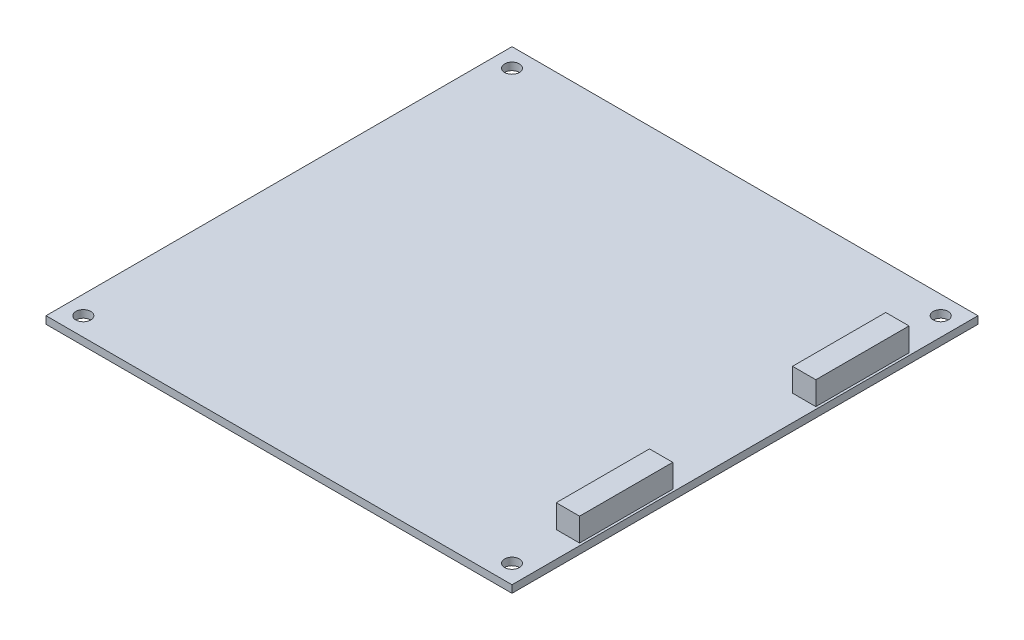
from build123d import *

# Parameters (mm, degrees)
SKETCH1_W           = 100
SKETCH1_H           = 100
BOSS_EXTRUDE1_DEPTH = 1.6
SKETCH2_R           = 1.6
CUT_EXTRUDE1_DEPTH  = 71.728777736
SKETCH3_W           = 5
SKETCH3_H           = 20
BOSS_EXTRUDE2_DEPTH = 5


with BuildPart() as part:
    # Sketch1 → Boss-Extrude1 (new body)
    with BuildSketch(Plane(origin=(0, 0, 0), x_dir=(1, 0, 0), z_dir=(0, 1, 0))):
        Rectangle(SKETCH1_W, SKETCH1_H)
    extrude(amount=BOSS_EXTRUDE1_DEPTH)

    # Sketch2 → Cut-Extrude1 (cut, through all)
    with BuildSketch(Plane(origin=(0, 1.6, 0), x_dir=(1, 0, 0), z_dir=(0, 1, 0))):
        with Locations((-46, -46)):
            Circle(SKETCH2_R)
        with Locations((-46, 46)):
            Circle(SKETCH2_R)
        with Locations((46, 46)):
            Circle(SKETCH2_R)
        with Locations((46, -46)):
            Circle(SKETCH2_R)
    extrude(amount=-CUT_EXTRUDE1_DEPTH, mode=Mode.SUBTRACT)

    # Sketch3 → Boss-Extrude2 (add)
    with BuildSketch(Plane(origin=(0, 1.6, 0), x_dir=(1, 0, 0), z_dir=(0, 1, 0))):
        with Locations((47, -25)):
            Rectangle(SKETCH3_W, SKETCH3_H)
        with Locations((47, 25.7)):
            Rectangle(SKETCH3_W, SKETCH3_H)
    extrude(amount=BOSS_EXTRUDE2_DEPTH)


solid = part.part
